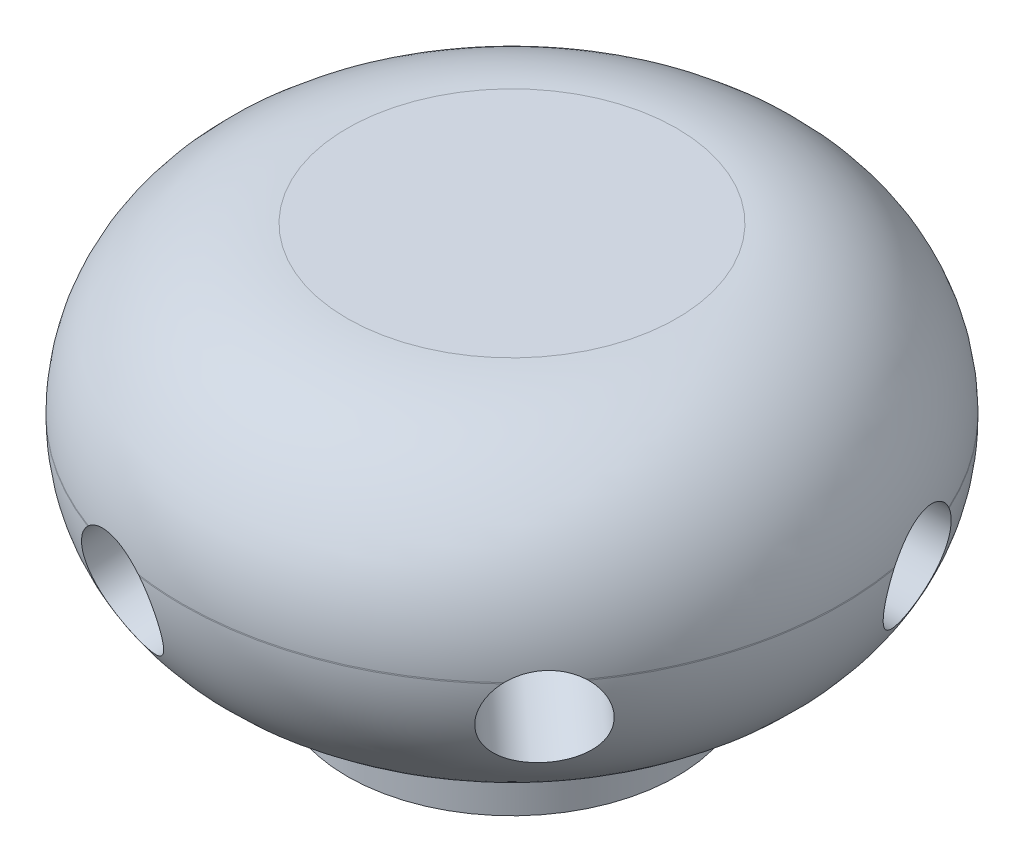
from build123d import *

# Parameters (mm, degrees)
BASE_DEPTH          = 3.035432218
BASE_DEPTH_BACK     = 7
SKETCH1_R           = 10
SKETCH3_R           = 1.6
HOLE2_DEPTH         = 19.445737436
HOLE2MIRROR_COUNT   = 2
SKETCH4_R           = 1.6
HOLE3_DEPTH         = 19.389503466
SKETCH5_R           = 1.5
CUT_EXTRUDE1_DEPTH  = 19.60459576
SKETCH6_R           = 1.5
CUT_EXTRUDE2_DEPTH  = 19.841947755
SKETCH7_R           = 1.5
CUT_EXTRUDE3_DEPTH  = 19.934353442
FILLET1_R           = 5
SKETCH8_R           = 5
BOSS_EXTRUDE1_DEPTH = 2


with BuildPart() as part:
    # Sketch1 → base (new, two sides: drawn at the far end of the back side and taken through both)
    with BuildSketch(Plane(origin=(0, 0, 0), x_dir=(1, 0, 0), z_dir=(0, 1, 0)).offset(-BASE_DEPTH_BACK)):
        with Locations(Location((0, 0, 0), (0, 0, 270))):
            Circle(SKETCH1_R)
    extrude(amount=BASE_DEPTH + BASE_DEPTH_BACK)

    # Sketch3 → hole2 (cut, through all)
    with BuildSketch(Plane(origin=(-0.941672921, -1.236067977, 3.685836142), x_dir=(-0.9718935871364875, 0.07382318789513377, -0.22354639834264944), z_dir=(0.23541823021467095, 0.3090169943749464, -0.921459035481267))):
        with Locations(Location((0, 0, 0), (0, 0, 90.062171088))):
            Circle(SKETCH3_R)
    hole2 = extrude(amount=-HOLE2_DEPTH, mode=Mode.SUBTRACT)

    # hole2mirror: hole2 ×2 about axis
    hole2mirror_axis = Axis((0, 5.5, 0), (0, -1, 0))
    for i in range(1, HOLE2MIRROR_COUNT):
        add(hole2.rotate(hole2mirror_axis, i * 360 / HOLE2MIRROR_COUNT), mode=Mode.SUBTRACT)

    # Sketch4 → hole3 (cut, through all)
    with BuildSketch(Plane(origin=(-3.717841, -1.236067977, 0.806098168), x_dir=(-0.19123247894507908, -0.06357892752956036, -0.979483465389136), z_dir=(0.9294602499075393, 0.30901699437494623, -0.20152454200243008))):
        with Locations(Location((0, 0, 0), (0, 0, 90))):
            Circle(SKETCH4_R)
    extrude(amount=-HOLE3_DEPTH, mode=Mode.SUBTRACT)

    # Sketch5 → Cut-Extrude1 (cut, through all)
    with BuildSketch(Plane(origin=(3.671965021, -1.093066116, -1.149730122), x_dir=(0.2754858058396647, -0.08200628219437099, 0.9578008876909271), z_dir=(-0.9179912552075574, 0.27326652891267317, 0.2874325304110031))):
        with Locations(Location((0, 0, 0), (0, 0, 4.890463))):
            Circle(SKETCH5_R)
    extrude(amount=-CUT_EXTRUDE1_DEPTH, mode=Mode.SUBTRACT)

    # Sketch6 → Cut-Extrude2 (cut, through all)
    with BuildSketch(Plane(origin=(2.875583134, -1.236067977, 2.490613899), x_dir=(-0.5720437997755544, 0.24589274231852376, 0.782497699941298), z_dir=(-0.7188957835464718, 0.30901699437494723, -0.6226534747245682))):
        with Locations(Location((0, 0, 0), (0, 0, 345.016140445))):
            Circle(SKETCH6_R)
    extrude(amount=-CUT_EXTRUDE2_DEPTH, mode=Mode.SUBTRACT)

    # Sketch7 → Cut-Extrude3 (cut, through all)
    with BuildSketch(Plane(origin=(-2.670502563, -1.093066116, -2.770130417), x_dir=(0.7444971483747472, -0.2450509606833859, -0.6210265877802813), z_dir=(0.6676256406564008, 0.2732665289126714, 0.6925326043690294))):
        with Locations(Location((0, 0, 0), (0, 0, 14.758597305))):
            Circle(SKETCH7_R)
    extrude(amount=-CUT_EXTRUDE3_DEPTH, mode=Mode.SUBTRACT)

    # Fillet1
    # the kernel refuses this fillet: 5 mm, written as the material it takes off along each edge
    with BuildSketch(Plane(origin=(0, 3.035432218, 0), x_dir=(0, 0, 1), z_dir=(-1, 0, 0))) as fillet1_piece_1:
        with BuildLine():
            CenterArc((10 - FILLET1_R, -FILLET1_R), FILLET1_R, 0, 90)
            Line((10 - FILLET1_R, 0), (10, 0))
            Line((10, 0), (10, -FILLET1_R))
        make_face()
    revolve(axis=Axis((0, 3.035432218, 0), (0, 1, 0)), mode=Mode.SUBTRACT)
    with BuildSketch(Plane(origin=(0, -7, 0), x_dir=(0, 0, 1), z_dir=(-1, 0, 0))) as fillet1_piece_2:
        with BuildLine():
            CenterArc((10 - FILLET1_R, FILLET1_R), FILLET1_R, 270, 90)
            Line((10 - FILLET1_R, 0), (10, 0))
            Line((10, 0), (10, FILLET1_R))
        make_face()
    revolve(axis=Axis((0, -7, 0), (0, 1, 0)), mode=Mode.SUBTRACT)

    # Sketch8 → Boss-Extrude1 (add)
    with BuildSketch(Plane.XZ.offset(7)):
        with Locations(Location((0, 0, 0), (0, 0, 90))):
            Circle(SKETCH8_R)
    extrude(amount=BOSS_EXTRUDE1_DEPTH)


solid = part.part
